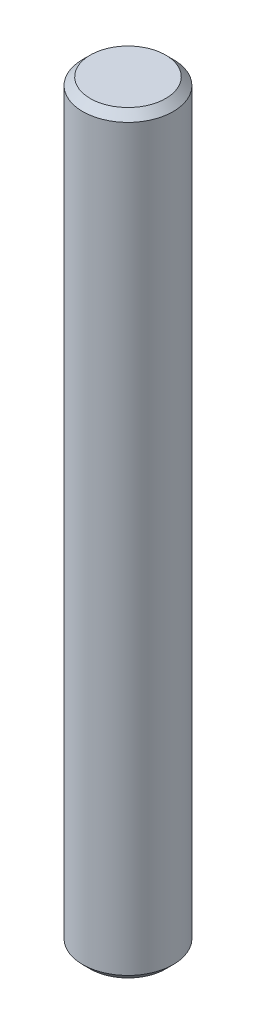
from build123d import *

# Parameters (mm, degrees)
SKETCH1_R           = 1.5
BOSS_EXTRUDE1_DEPTH = 25
CHAMFER1_SIZE       = 0.25


with BuildPart() as part:
    # Sketch1 → Boss-Extrude1 (new body)
    with BuildSketch(Plane(origin=(0, 0, 0), x_dir=(1, 0, 0), z_dir=(0, 1, 0))):
        Circle(SKETCH1_R)
    extrude(amount=BOSS_EXTRUDE1_DEPTH)

    # Chamfer1
    chamfer1_edges = [part.edges().sort_by_distance(p)[0] for p in [
        (-1.5, 25, 0),
        (-1.5, 0, 0),
    ]]
    chamfer(chamfer1_edges, length=CHAMFER1_SIZE)


solid = part.part
